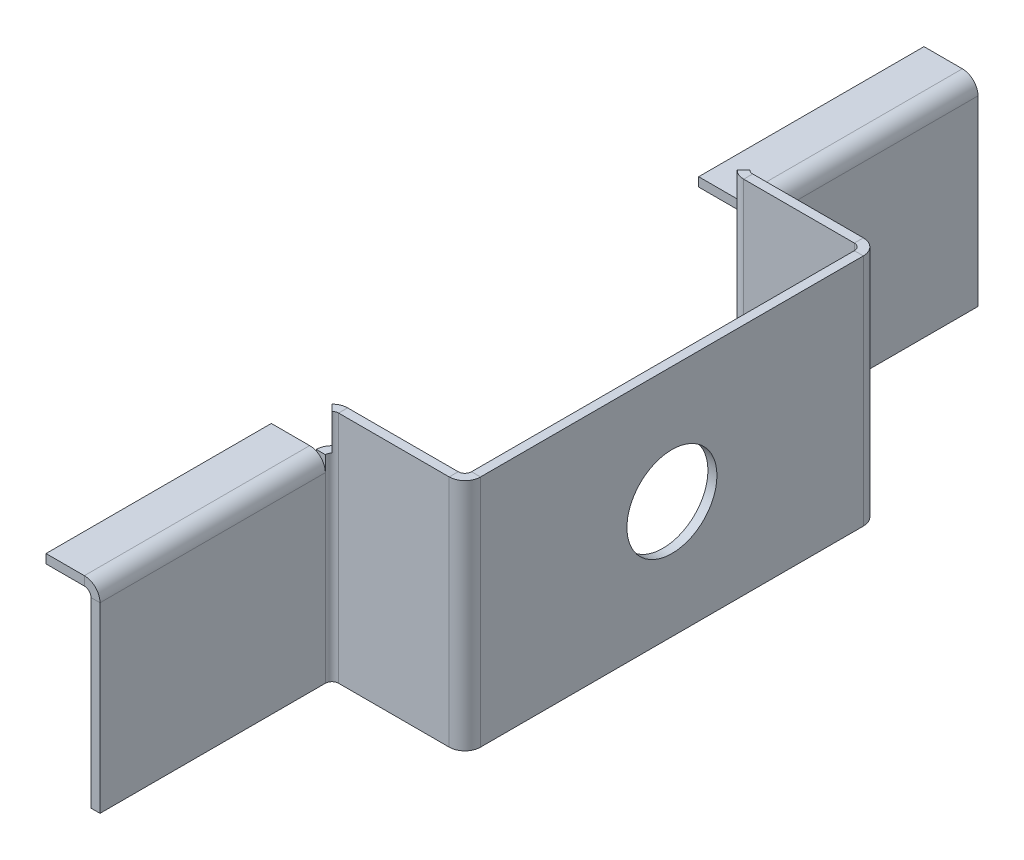
from build123d import *

# Parameters (mm, degrees)
SKETCH17_W                   = 46
SKETCH17_H                   = 26
BASE_FLANGE4_DEPTH           = 1
EDGE_FLANGE1_STRIP_W         = 5.4732
EDGE_FLANGE1_STRIP_H         = 1
EDGE_FLANGE1_STRIP_CUT_DEPTH = 26
EDGE_FLANGE1_DEPTH           = 26
SKETCH30_W                   = 26
SKETCH30_H                   = 22
TAB1_DEPTH                   = 1
SKETCHED_BEND3_DEPTH         = 26
SKETCHED_START               = 22
SKETCHED_BEND3_2_DEPTH       = 4
SKETCHED_BEND3_3_DEPTH       = 26
SKETCHED_BEND3_4_DEPTH       = 22
EDGE_FLANGE2_STRIP_W         = 5.4732
EDGE_FLANGE2_STRIP_H         = 1
EDGE_FLANGE2_STRIP_CUT_DEPTH = 25.028776631
EDGE_FLANGE2_DEPTH           = 25.028776631
EDGE_FLANGE3_STRIP_W         = 5.4732
EDGE_FLANGE3_STRIP_H         = 1
EDGE_FLANGE3_STRIP_CUT_DEPTH = 26
EDGE_FLANGE3_DEPTH           = 26
SKETCH40_W                   = 26
SKETCH40_H                   = 22
TAB2_DEPTH                   = 1
SKETCHED_BEND4_DEPTH         = 26
SKETCHED_BEND4_2_DEPTH       = 4
SKETCHED_BEND4_3_DEPTH       = 22
SKETCHED_BEND4_4_DEPTH       = 4
EDGE_FLANGE4_STRIP_W         = 5.4732
EDGE_FLANGE4_STRIP_H         = 1
EDGE_FLANGE4_STRIP_CUT_DEPTH = 25.028776631
EDGE_FLANGE4_DEPTH           = 25.028776631
SKETCH47_R                   = 5
CUT_EXTRUDE1_DEPTH           = 10


# Read off the part's stored shape, not the designer's step: Sketched Bend3, Sketched Bend4
# Sheet-metal steps are written as plain solids
with BuildPart() as part:
    # Sketch17 → Base-Flange4 (new body)
    with BuildSketch(Plane.XY):
        with Locations((23, 13)):
            Rectangle(SKETCH17_W, SKETCH17_H)
    extrude(amount=-BASE_FLANGE4_DEPTH)

    # Edge-Flange1 strip (across the edge) → Edge-Flange1 strip cut (cut)
    with BuildSketch(Plane(origin=(46, 0, 0), x_dir=(-1, 0, 0), z_dir=(0, 1, 0))):
        with Locations((-1, -0.5)):
            Rectangle(EDGE_FLANGE1_STRIP_W, EDGE_FLANGE1_STRIP_H)
    extrude(amount=EDGE_FLANGE1_STRIP_CUT_DEPTH, mode=Mode.SUBTRACT)

    # Edge-Flange1 section (across the edge) → Edge-Flange1 (add)
    with BuildSketch(Plane(origin=(46, 0, 0), x_dir=(-1, 0, 0), z_dir=(0, 1, 0))):
        with BuildLine():
            Line((0, 0.7366), (0, 14))
            Line((0, 14), (1, 14))
            Line((1, 14), (1, 0.7366))
            ThreePointArc((1, 0.7366), (1.215745145, 0.215745145), (1.7366, 0))
            Line((1.7366, 0), (1.7366, -1))
            ThreePointArc((1.7366, -1), (0.508638364, -0.491361636), (0, 0.7366))
        make_face()
    extrude(amount=EDGE_FLANGE1_DEPTH)

    # Sketch30 → Tab1 (add)
    with BuildSketch(Plane(origin=(46, 0, 0), x_dir=(0, 0, -1), z_dir=(1, 0, 0))):
        with Locations((-27, 11)):
            Rectangle(SKETCH30_W, SKETCH30_H)
    extrude(amount=-TAB1_DEPTH)

    # Sketched Bend3 outline → Sketched Bend3 (cut)
    with BuildSketch(Plane(origin=(0, 0, 0), x_dir=(1, 0, 0), z_dir=(0, 1, 0))):
        with BuildLine():
            Line((46, -13.398582279), (46, -0.7366))
            ThreePointArc((46, -0.7366), (45.491361636, 0.491361636), (44.2634, 1))
            Line((44.2634, 1), (0, 1))
            Line((0, 1), (0, 0))
            Line((0, 0), (44.2634, 0))
            ThreePointArc((44.2634, 0), (44.784254855, -0.215745145), (45, -0.7366))
            Line((45, -0.7366), (45, -14.971223369))
            ThreePointArc((45, -14.971223369), (45.271171885, -14.039397205), (46, -13.398582279))
        make_face()
    extrude(amount=SKETCHED_BEND3_DEPTH, mode=Mode.SUBTRACT)

    # Sketched Bend3 2 outline → Sketched Bend3 2 (cut)
    with BuildSketch(Plane(origin=(0, 0, 0), x_dir=(1, 0, 0), z_dir=(0, 1, 0)).offset(SKETCHED_START)):
        with BuildLine():
            Line((45.296980354, -14), (45.765376631, -14))
            Line((45.765376631, -14), (45.508638364, -13.743261733))
            ThreePointArc((45.508638364, -13.743261733), (45.396646229, -13.866549911), (45.296980354, -14))
        make_face()
    extrude(amount=SKETCHED_BEND3_2_DEPTH, mode=Mode.SUBTRACT)

    # Sketched Bend3 3 outline → Sketched Bend3 3 (add)
    with BuildSketch(Plane(origin=(0, 0, 0), x_dir=(1, 0, 0), z_dir=(0, 1, 0))):
        with BuildLine():
            Line((46.7366, -14.234623369), (59.028776631, -14.234623369))
            ThreePointArc((59.028776631, -14.234623369), (60.256738267, -13.725985005), (60.765376631, -12.498023369))
            Line((60.765376631, -12.498023369), (60.765376631, 31.765376631))
            Line((60.765376631, 31.765376631), (59.765376631, 31.765376631))
            Line((59.765376631, 31.765376631), (59.765376631, -12.498023369))
            ThreePointArc((59.765376631, -12.498023369), (59.549631486, -13.018878224), (59.028776631, -13.234623369))
            Line((59.028776631, -13.234623369), (46.7366, -13.234623369))
            ThreePointArc((46.7366, -13.234623369), (46.359286442, -13.276108612), (46, -13.398582279))
            Line((46, -13.398582279), (46, -14))
            Line((46, -14), (45.765376631, -14))
            Line((45.765376631, -14), (46.215745145, -14.450368514))
            ThreePointArc((46.215745145, -14.450368514), (46.454715384, -14.290693705), (46.7366, -14.234623369))
        make_face()
    extrude(amount=SKETCHED_BEND3_3_DEPTH)

    # Sketched Bend3 4 outline → Sketched Bend3 4 (add)
    with BuildSketch(Plane(origin=(0, 0, 0), x_dir=(1, 0, 0), z_dir=(0, 1, 0))):
        with BuildLine():
            ThreePointArc((46, -14.971223369), (46.056070336, -14.689338753), (46.215745145, -14.450368514))
            Line((46.215745145, -14.450368514), (46, -14.234623369))
            Line((46, -14.234623369), (46, -14.971223369))
        make_face()
    extrude(amount=SKETCHED_BEND3_4_DEPTH)

    # Edge-Flange2 strip (across the edge) → Edge-Flange2 strip cut (cut)
    with BuildSketch(Plane(origin=(45, 22, 40), x_dir=(0, -1, 0), z_dir=(0, 0, -1))):
        with Locations((-1, -0.5)):
            Rectangle(EDGE_FLANGE2_STRIP_W, EDGE_FLANGE2_STRIP_H)
    extrude(amount=EDGE_FLANGE2_STRIP_CUT_DEPTH, mode=Mode.SUBTRACT)

    # Edge-Flange2 section (across the edge) → Edge-Flange2 (add)
    with BuildSketch(Plane(origin=(45, 22, 40), x_dir=(0, -1, 0), z_dir=(0, 0, -1))):
        with BuildLine():
            Line((0, 0.7366), (0, 5))
            Line((0, 5), (1, 5))
            Line((1, 5), (1, 0.7366))
            ThreePointArc((1, 0.7366), (1.215745145, 0.215745145), (1.7366, 0))
            Line((1.7366, 0), (1.7366, -1))
            ThreePointArc((1.7366, -1), (0.508638364, -0.491361636), (0, 0.7366))
        make_face()
    extrude(amount=EDGE_FLANGE2_DEPTH)

    # Edge-Flange3 strip (across the edge) → Edge-Flange3 strip cut (cut)
    with BuildSketch(Plane(origin=(59.765376631, 26, -31.765376631), x_dir=(0, 0, 1), z_dir=(0, -1, 0))):
        with Locations((-1, -0.5)):
            Rectangle(EDGE_FLANGE3_STRIP_W, EDGE_FLANGE3_STRIP_H)
    extrude(amount=EDGE_FLANGE3_STRIP_CUT_DEPTH, mode=Mode.SUBTRACT)

    # Edge-Flange3 section (across the edge) → Edge-Flange3 (add)
    with BuildSketch(Plane(origin=(59.765376631, 26, -31.765376631), x_dir=(0, 0, 1), z_dir=(0, -1, 0))):
        with BuildLine():
            Line((0, 0.7366), (0, 14))
            Line((0, 14), (1, 14))
            Line((1, 14), (1, 0.7366))
            ThreePointArc((1, 0.7366), (1.215745145, 0.215745145), (1.7366, 0))
            Line((1.7366, 0), (1.7366, -1))
            ThreePointArc((1.7366, -1), (0.508638364, -0.491361636), (0, 0.7366))
        make_face()
    extrude(amount=EDGE_FLANGE3_DEPTH)

    # Sketch40 → Tab2 (add)
    with BuildSketch(Plane(origin=(0, 0, -31.765376631), x_dir=(-1, 0, 0), z_dir=(0, 0, -1))):
        with Locations((-32.765376631, 11)):
            Rectangle(SKETCH40_W, SKETCH40_H)
    extrude(amount=-TAB2_DEPTH)

    # Sketched Bend4 outline → Sketched Bend4 (cut)
    with BuildSketch(Plane(origin=(0, 0, 0), x_dir=(1, 0, 0), z_dir=(0, 1, 0))):
        with BuildLine():
            Line((45.16395891, 31.765376631), (19.765376631, 31.765376631))
            Line((19.765376631, 31.765376631), (19.765376631, 30.765376631))
            Line((19.765376631, 30.765376631), (46.7366, 30.765376631))
            ThreePointArc((46.7366, 30.765376631), (45.804773836, 31.036548516), (45.16395891, 31.765376631))
        make_face()
    extrude(amount=SKETCHED_BEND4_DEPTH, mode=Mode.SUBTRACT)

    # Sketched Bend4 2 outline → Sketched Bend4 2 (cut)
    with BuildSketch(Plane(origin=(0, 0, 0), x_dir=(1, 0, 0), z_dir=(0, 1, 0)).offset(SKETCHED_START)):
        Polygon((45.765376631, 31.530753262), (46, 31.765376631), (45.765376631, 31.765376631), align=None)
    extrude(amount=SKETCHED_BEND4_2_DEPTH, mode=Mode.SUBTRACT)

    # Sketched Bend4 3 outline → Sketched Bend4 3 (add)
    with BuildSketch(Plane(origin=(0, 0, 0), x_dir=(1, 0, 0), z_dir=(0, 1, 0))):
        with BuildLine():
            Line((46, 32.501976631), (46, 57.530753262))
            Line((46, 57.530753262), (45, 57.530753262))
            Line((45, 57.530753262), (45, 32.501976631))
            ThreePointArc((45, 32.501976631), (45.041485243, 32.124663073), (45.16395891, 31.765376631))
            Line((45.16395891, 31.765376631), (46.7366, 31.765376631))
            ThreePointArc((46.7366, 31.765376631), (46.215745145, 31.981121776), (46, 32.501976631))
        make_face()
    extrude(amount=SKETCHED_BEND4_3_DEPTH)

    # Sketched Bend4 4 outline → Sketched Bend4 4 (add)
    with BuildSketch(Plane(origin=(0, 0, 0), x_dir=(1, 0, 0), z_dir=(0, 1, 0)).offset(SKETCHED_START)):
        with BuildLine():
            ThreePointArc((46.7366, 31.765376631), (46.454715384, 31.821446967), (46.215745145, 31.981121776))
            Line((46.215745145, 31.981121776), (46, 31.765376631))
            Line((46, 31.765376631), (46.7366, 31.765376631))
        make_face()
        with BuildLine():
            Line((45.765376631, 31.062356985), (45.765376631, 31.530753262))
            Line((45.765376631, 31.530753262), (45.508638364, 31.274014995))
            ThreePointArc((45.508638364, 31.274014995), (45.631926542, 31.16202286), (45.765376631, 31.062356985))
        make_face()
    extrude(amount=SKETCHED_BEND4_4_DEPTH)

    # Edge-Flange4 strip (across the edge) → Edge-Flange4 strip cut (cut)
    with BuildSketch(Plane(origin=(45, 22, -32.501976631), x_dir=(0, -1, 0), z_dir=(0, 0, -1))):
        with Locations((-1, -0.5)):
            Rectangle(EDGE_FLANGE4_STRIP_W, EDGE_FLANGE4_STRIP_H)
    extrude(amount=EDGE_FLANGE4_STRIP_CUT_DEPTH, mode=Mode.SUBTRACT)

    # Edge-Flange4 section (across the edge) → Edge-Flange4 (add)
    with BuildSketch(Plane(origin=(45, 22, -32.501976631), x_dir=(0, -1, 0), z_dir=(0, 0, -1))):
        with BuildLine():
            Line((0, 0.7366), (0, 5))
            Line((0, 5), (1, 5))
            Line((1, 5), (1, 0.7366))
            ThreePointArc((1, 0.7366), (1.215745145, 0.215745145), (1.7366, 0))
            Line((1.7366, 0), (1.7366, -1))
            ThreePointArc((1.7366, -1), (0.508638364, -0.491361636), (0, 0.7366))
        make_face()
    extrude(amount=EDGE_FLANGE4_DEPTH)

    # Sketch47 → Cut-Extrude1 (cut)
    with BuildSketch(Plane(origin=(60.765376631, 0, 0), x_dir=(0, 0, -1), z_dir=(1, 0, 0))):
        with Locations((8.765376631, 13)):
            Circle(SKETCH47_R)
    extrude(amount=-CUT_EXTRUDE1_DEPTH, mode=Mode.SUBTRACT)


solid = part.part
